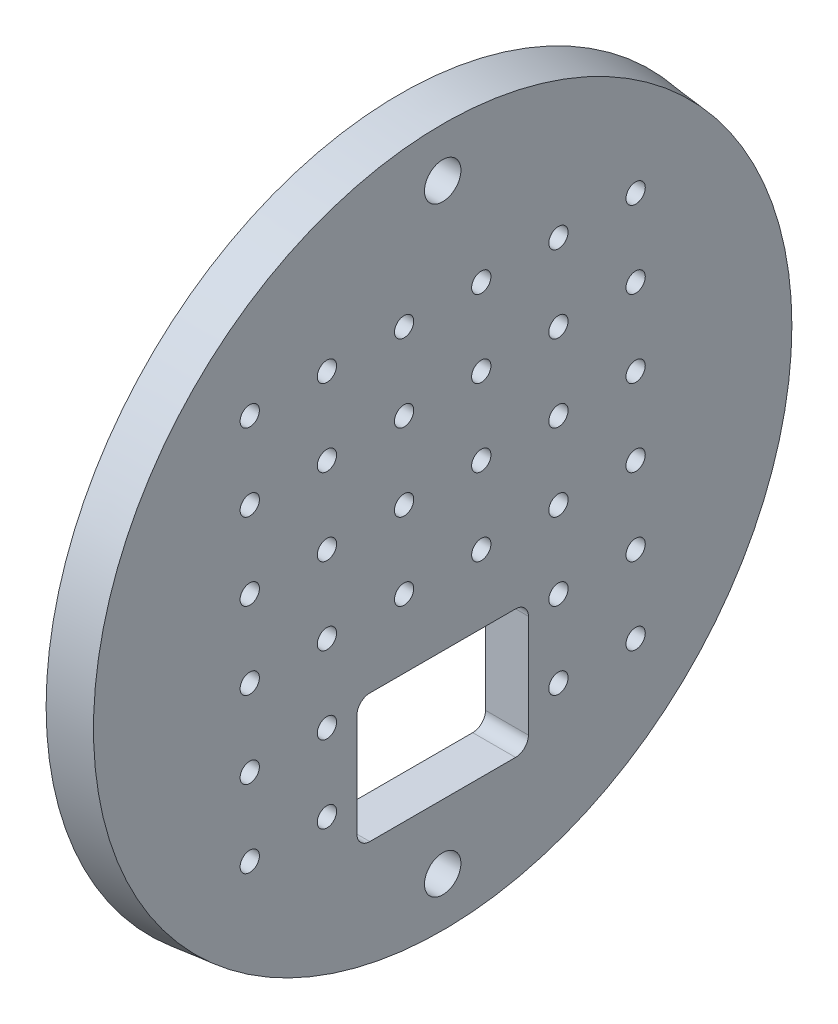
from build123d import *

# Parameters (mm, degrees)
SKETCH_1_R                  = 82.5
EXTRUDE_1_DEPTH             = 10
EXTRUDE_1_TAPER             = 6
SKETCH_2_R                  = 4.25
CUT_EXTRUDE_458_DEPTH       = 118.100384436
CUT_EXTRUDE_1221_REACH      = 119.1
CUT_EXTRUDE_1_REACH         = 119.1
SKETCH_7_R                  = 2.25
PATTERN_LINEAR_1_COUNT      = 6
PATTERN_LINEAR_1_PITCH      = 18
PATTERN_LINEAR_1_COUNT_DIR2 = 6
PATTERN_LINEAR_1_PITCH_DIR2 = 18
WRAP_START                  = -0.3
WRAP_1_DEPTH                = 0.3


# Read off the part's stored shape, not the designer's step: 包覆1
with BuildPart() as part:
    # 草圖1 → 填料-伸長1 (new body)
    with BuildSketch(Plane(origin=(0, 0, 0), x_dir=(0, 0, -1), z_dir=(1, 0, 0))):
        Circle(SKETCH_1_R)
    extrude(amount=EXTRUDE_1_DEPTH, taper=EXTRUDE_1_TAPER)

    # 草圖2 → Cut-Extrude 458 (cut, through all)
    with BuildSketch(Plane(origin=(10, 0, 0), x_dir=(0, 0, -1), z_dir=(1, 0, 0))):
        with Locations((0, 70)):
            Circle(SKETCH_2_R)
        with Locations(Location((0, -70, 0), (0, 0, 180))):
            Circle(SKETCH_2_R)
    extrude(amount=-CUT_EXTRUDE_458_DEPTH, mode=Mode.SUBTRACT)

    # 草圖8 → Cut-Extrude 1221 (cut, up to next)
    with BuildSketch(Plane(origin=(10, 0, 0), x_dir=(0, 0, -1), z_dir=(1, 0, 0)), mode=Mode.PRIVATE) as cut_extrude_1221_sk1:
        with BuildLine():
            Line((-17, -25), (17, -25))
            ThreePointArc((17, -25), (19.121320344, -25.878679656), (20, -28))
            Line((20, -28), (20, -52))
            ThreePointArc((20, -52), (19.121320344, -54.121320344), (17, -55))
            Line((17, -55), (-17, -55))
            ThreePointArc((-17, -55), (-19.121320344, -54.121320344), (-20, -52))
            Line((-20, -52), (-20, -28))
            ThreePointArc((-20, -28), (-19.121320344, -25.878679656), (-17, -25))
        make_face()
    cut_extrude_1221_tool1 = extrude(cut_extrude_1221_sk1.sketch, amount=-CUT_EXTRUDE_1221_REACH, mode=Mode.PRIVATE) & part.part
    add(cut_extrude_1221_tool1.solids().sort_by_distance((10, -40, 0))[0], mode=Mode.SUBTRACT)

    # 草圖7 → 除料-伸長1 (cut, up to next)
    with BuildSketch(Plane(origin=(10, 0, 0), x_dir=(0, 0, -1), z_dir=(1, 0, 0)), mode=Mode.PRIVATE) as cut_extrude_1_sk1:
        with Locations((-45, 45)):
            Circle(SKETCH_7_R)
    cut_extrude_1_tool1 = extrude(cut_extrude_1_sk1.sketch, amount=-CUT_EXTRUDE_1_REACH, mode=Mode.PRIVATE) & part.part
    cut_extrude_1 = cut_extrude_1_tool1.solids().sort_by_distance((10, 45, 45))[0]
    add(cut_extrude_1, mode=Mode.SUBTRACT)

    # 直線複製排列1: Cut-Extrude 1 6 × 6, 4 skipped
    with Locations(*[(0, -i * PATTERN_LINEAR_1_PITCH, -j * PATTERN_LINEAR_1_PITCH_DIR2) for i in range(PATTERN_LINEAR_1_COUNT) for j in range(PATTERN_LINEAR_1_COUNT_DIR2) if (i, j) not in ((0, 0), (4, 2), (4, 3), (5, 2), (5, 3))]):
        add(cut_extrude_1, mode=Mode.SUBTRACT)

    # 包覆1 outline → 包覆1 (cut)
    # profile 1 of 5: a face of its own
    with BuildSketch(Plane.ZY.offset(WRAP_START)):
        with BuildLine():
            add(Edge.make_bspline(
                [(4.76091402, -64.338842147), (4.738677425, -64.378285479), (4.695413817, -64.455026582), (4.621013069, -64.560458442), (4.543020996, -64.655306158), (4.457917028, -64.737035812), (4.368247349, -64.808287197), (4.273514695, -64.870625022), (4.173225877, -64.923743542), (4.067376152, -64.96849607), (3.955076601, -65.002905564), (3.836055084, -65.027209785), (3.710083589, -65.042233054), (3.623737409, -65.043978194), (3.579523796, -65.044871795)],
                knots=[0, 0, 0, 0, 0.093369857, 0.181660766, 0.265874227, 0.346354784, 0.424599862, 0.501903184, 0.579992091, 0.658443431, 0.738672236, 0.821894148, 0.908800792, 1, 1, 1, 1], degree=3))
            Line((4.76091402, -64.338842147), (4.481867546, -64.192307692))
            add(Edge.make_bspline(
                [(3.540260976, -64.730769231), (3.571612123, -64.730161174), (3.633818814, -64.728954673), (3.726459671, -64.717222762), (3.817599199, -64.698252487), (3.906860182, -64.672362496), (3.992431028, -64.640785644), (4.071676578, -64.602682787), (4.144556794, -64.56053304), (4.21267376, -64.512323365), (4.278744754, -64.453315178), (4.34428724, -64.379679457), (4.414563893, -64.292591929), (4.458553486, -64.227046263), (4.481867546, -64.192307692)],
                knots=[0, 0, 0, 0, 0.082592263, 0.163878894, 0.24565874, 0.327725695, 0.408609961, 0.485749086, 0.559169056, 0.630268476, 0.705306028, 0.792064966, 0.889796437, 1, 1, 1, 1], degree=3))
            add(Edge.make_bspline(
                [(2.607067867, -63.788461538), (2.608607473, -63.822162003), (2.611635047, -63.888432606), (2.62575019, -63.98540339), (2.647998964, -64.077776732), (2.679268027, -64.164859774), (2.717134872, -64.247789901), (2.763520589, -64.325951938), (2.818860143, -64.398989868), (2.880585842, -64.467557006), (2.949292937, -64.528617767), (3.021575684, -64.583269543), (3.098469249, -64.62907514), (3.179367333, -64.66625503), (3.264139118, -64.695361346), (3.352811313, -64.715229166), (3.44520943, -64.728536273), (3.508195164, -64.730015939), (3.540260976, -64.730769231)],
                knots=[0, 0, 0, 0, 0.068384615, 0.134475588, 0.198391058, 0.260753477, 0.321829223, 0.383037238, 0.444653123, 0.507398011, 0.569825238, 0.630777641, 0.690928687, 0.750945133, 0.811049477, 0.872330853, 0.935004094, 1, 1, 1, 1], degree=3))
            Line((2.607067867, -63.788461538), (4.895529405, -63.788461538))
            add(Edge.make_bspline(
                [(4.617184053, -62.900841346), (4.639310991, -62.931044928), (4.683417584, -62.991251046), (4.738664684, -63.089422203), (4.786622079, -63.192132798), (4.82495504, -63.301043095), (4.855994541, -63.414862675), (4.87845136, -63.53440522), (4.891620978, -63.659635131), (4.894209676, -63.744961686), (4.895529405, -63.788461538)],
                knots=[0, 0, 0, 0, 0.11852184, 0.236254763, 0.356174434, 0.477249655, 0.601539871, 0.729618382, 0.862158266, 1, 1, 1, 1], degree=3))
            add(Edge.make_bspline(
                [(3.587236136, -62.397435897), (3.639683741, -62.398789946), (3.742573987, -62.401446282), (3.892606108, -62.426072615), (4.034566825, -62.46512517), (4.168399329, -62.52027896), (4.29411719, -62.591438512), (4.410903239, -62.679580353), (4.520754752, -62.781998441), (4.584663331, -62.86076165), (4.617184053, -62.900841346)],
                knots=[0, 0, 0, 0, 0.132040234, 0.259032841, 0.381879824, 0.502258444, 0.62275219, 0.744742632, 0.870108927, 1, 1, 1, 1], degree=3))
            add(Edge.make_bspline(
                [(2.587436456, -62.874198718), (2.619144139, -62.836329848), (2.681555086, -62.761791697), (2.787111441, -62.663853372), (2.901411637, -62.581809596), (3.023023264, -62.51380246), (3.153359738, -62.462128813), (3.290669029, -62.423621231), (3.436514615, -62.40204322), (3.536219836, -62.398995386), (3.587236136, -62.397435897)],
                knots=[0, 0, 0, 0, 0.128835254, 0.253589335, 0.374643257, 0.495340042, 0.616324775, 0.739759335, 0.86684232, 1, 1, 1, 1], degree=3))
            add(Edge.make_bspline(
                [(2.292965303, -63.728165064), (2.294024444, -63.688870234), (2.296123522, -63.610993069), (2.309354309, -63.495727524), (2.332802603, -63.383699072), (2.364978926, -63.274814624), (2.406530173, -63.16925649), (2.457362392, -63.066960426), (2.51755477, -62.968035287), (2.564027443, -62.905632153), (2.587436456, -62.874198718)],
                knots=[0, 0, 0, 0, 0.128044808, 0.2537679, 0.377428427, 0.500550841, 0.623295883, 0.746578332, 0.872347541, 1, 1, 1, 1], degree=3))
            add(Edge.make_bspline(
                [(3.579523796, -65.044871795), (3.530381819, -65.04372462), (3.434520057, -65.041486813), (3.29498031, -65.022194348), (3.163600891, -64.99072199), (3.040389188, -64.946756448), (2.925646935, -64.889329124), (2.819146081, -64.819369642), (2.720326555, -64.737237388), (2.632302346, -64.642220944), (2.553058463, -64.540538987), (2.483132643, -64.434583102), (2.424675212, -64.324619878), (2.377122602, -64.211349354), (2.338717737, -64.09548546), (2.311951033, -63.975973993), (2.296521285, -63.853138408), (2.294156839, -63.770041073), (2.292965303, -63.728165064)],
                knots=[0, 0, 0, 0, 0.071578658, 0.139629225, 0.204796697, 0.268134963, 0.329813747, 0.391301398, 0.453433515, 0.51655169, 0.579631271, 0.641118921, 0.701294047, 0.760810336, 0.819931722, 0.878919575, 0.938982822, 1, 1, 1, 1], degree=3))
        make_face()
        with BuildLine():
            add(Edge.make_bspline(
                [(3.603361937, -62.711538462), (3.572012499, -62.712150133), (3.51004125, -62.713359279), (3.418740181, -62.724829408), (3.331060482, -62.743789253), (3.246355195, -62.76975421), (3.165734326, -62.804362812), (3.087539558, -62.844946039), (3.013759162, -62.894487623), (2.967617867, -62.932246478), (2.94430745, -62.951322115)],
                knots=[0, 0, 0, 0, 0.131091976, 0.259141276, 0.384161763, 0.505991952, 0.629098089, 0.750669123, 0.874038938, 1, 1, 1, 1], degree=3))
            add(Edge.make_bspline(
                [(4.581426841, -63.474358974), (4.569930216, -63.432696101), (4.547802915, -63.35250848), (4.50156655, -63.24146759), (4.44949501, -63.142779689), (4.387873278, -63.057200056), (4.318054553, -62.981196543), (4.23740937, -62.914777957), (4.146973477, -62.855360506), (4.047214336, -62.805208007), (3.941572551, -62.762518148), (3.830966359, -62.733893032), (3.718108571, -62.71428349), (3.641774285, -62.712457382), (3.603361937, -62.711538462)],
                knots=[0, 0, 0, 0, 0.096240125, 0.185231261, 0.267500523, 0.344400382, 0.419594869, 0.496890627, 0.576637919, 0.660267852, 0.745386615, 0.830040327, 0.914474212, 1, 1, 1, 1], degree=3))
            Line((4.581426841, -63.474358974), (2.640020591, -63.474358974))
            add(Edge.make_bspline(
                [(2.94430745, -62.951322115), (2.927614168, -62.966416431), (2.893831034, -62.996963647), (2.848690512, -63.049592854), (2.80547004, -63.106344416), (2.766136387, -63.16938954), (2.7300588, -63.238010319), (2.696298823, -63.311627955), (2.665912411, -63.390801085), (2.648816301, -63.445973524), (2.640020591, -63.474358974)],
                knots=[0, 0, 0, 0, 0.109983845, 0.222580497, 0.338499871, 0.458708565, 0.585535346, 0.717517743, 0.85466682, 1, 1, 1, 1], degree=3))
        make_face(mode=Mode.SUBTRACT)
    # profile 2 of 5: a face of its own
    with BuildSketch(Plane.ZY.offset(WRAP_START)):
        with BuildLine():
            add(Edge.make_bspline(
                [(1.496490944, -62.980769231), (1.47810044, -62.959456084), (1.442645714, -62.918366847), (1.386414233, -62.863429781), (1.33039063, -62.817292842), (1.275341816, -62.778340583), (1.219883547, -62.748891436), (1.164666629, -62.727396574), (1.10963389, -62.714094769), (1.072847855, -62.71238033), (1.054784213, -62.711538462)],
                knots=[0, 0, 0, 0, 0.158223098, 0.305035505, 0.441308964, 0.565963227, 0.683525114, 0.79333413, 0.898517512, 1, 1, 1, 1], degree=3))
            Line((1.496490944, -62.980769231), (1.709631969, -62.761318109))
            add(Edge.make_bspline(
                [(1.054784213, -62.397435897), (1.081976276, -62.398540238), (1.136870498, -62.400769636), (1.219225124, -62.418475326), (1.301458466, -62.447608431), (1.383781816, -62.487844664), (1.465592106, -62.53991154), (1.547608962, -62.602840839), (1.630816992, -62.676218554), (1.682773306, -62.732317779), (1.709631969, -62.761318109)],
                knots=[0, 0, 0, 0, 0.105714261, 0.213411613, 0.32612673, 0.444451672, 0.56906108, 0.702712204, 0.846317947, 1, 1, 1, 1], degree=3))
            add(Edge.make_bspline(
                [(0.408349918, -63.068409455), (0.408884113, -63.044784057), (0.409929609, -62.998545806), (0.418273661, -62.930606986), (0.433465372, -62.866058832), (0.452520295, -62.803931969), (0.479003299, -62.745429875), (0.510649204, -62.689772404), (0.547836629, -62.637036486), (0.59067992, -62.588033354), (0.637786565, -62.543524028), (0.688681335, -62.5047254), (0.742219591, -62.471619045), (0.798628011, -62.443853884), (0.858448484, -62.422852502), (0.92126287, -62.408395117), (0.986944025, -62.398739914), (1.031845151, -62.397876829), (1.054784213, -62.397435897)],
                knots=[0, 0, 0, 0, 0.06797849, 0.133043535, 0.196507438, 0.258613417, 0.319728338, 0.380872854, 0.442635602, 0.505079304, 0.56788052, 0.628813854, 0.688910091, 0.748765006, 0.809385783, 0.870884336, 0.934037463, 1, 1, 1, 1], degree=3))
            add(Edge.make_bspline(
                [(0.525437258, -63.462439904), (0.507306658, -63.433294289), (0.471039123, -63.374992874), (0.435823932, -63.277682397), (0.411617903, -63.175237339), (0.409455513, -63.104550485), (0.408349918, -63.068409455)],
                knots=[0, 0, 0, 0, 0.246252371, 0.492590796, 0.740569991, 1, 1, 1, 1], degree=3))
            add(Edge.make_bspline(
                [(0.966442867, -63.811598558), (0.940396227, -63.797059426), (0.889883479, -63.76886341), (0.818336188, -63.724947329), (0.753788834, -63.680280055), (0.694688259, -63.637367216), (0.642527254, -63.593946272), (0.597511305, -63.54996902), (0.55786809, -63.507209034), (0.535920678, -63.476911737), (0.525437258, -63.462439904)],
                knots=[0, 0, 0, 0, 0.157761664, 0.305950213, 0.443775499, 0.572824362, 0.692154156, 0.802295707, 0.905564392, 1, 1, 1, 1], degree=3))
            add(Edge.make_bspline(
                [(1.354163219, -64.075220353), (1.346140825, -64.06618499), (1.328665152, -64.046502708), (1.296609911, -64.01807763), (1.258228049, -63.98743953), (1.213087886, -63.955107941), (1.161098424, -63.921509336), (1.102048949, -63.886819984), (1.036748396, -63.849392258), (0.990577765, -63.824572603), (0.966442867, -63.811598558)],
                knots=[0, 0, 0, 0, 0.076875074, 0.167461676, 0.272270023, 0.389550841, 0.520801368, 0.666263293, 0.825544915, 1, 1, 1, 1], degree=3))
            add(Edge.make_bspline(
                [(1.4404012, -64.319210737), (1.439314906, -64.296901119), (1.437170163, -64.252853763), (1.420326891, -64.189103422), (1.393714039, -64.128634141), (1.36750939, -64.093244494), (1.354163219, -64.075220353)],
                knots=[0, 0, 0, 0, 0.253475435, 0.500453315, 0.745578135, 1, 1, 1, 1], degree=3))
            add(Edge.make_bspline(
                [(0.988878764, -64.730769231), (1.01919669, -64.729398406), (1.078432832, -64.726720044), (1.16327659, -64.702402952), (1.241615217, -64.664273), (1.309638562, -64.610188302), (1.367540723, -64.547232729), (1.409468898, -64.47631861), (1.435745073, -64.399527153), (1.438831072, -64.346294851), (1.4404012, -64.319210737)],
                knots=[0, 0, 0, 0, 0.134042046, 0.261895674, 0.387836045, 0.517686206, 0.644508654, 0.764718263, 0.880290782, 1, 1, 1, 1], degree=3))
            add(Edge.make_bspline(
                [(0.481967706, -64.461538462), (0.501740119, -64.482893226), (0.540071932, -64.524292666), (0.601373148, -64.579417007), (0.663752549, -64.625618278), (0.726587236, -64.664261693), (0.79080733, -64.694037096), (0.856052945, -64.71495569), (0.922191369, -64.728399882), (0.966613504, -64.729978164), (0.988878764, -64.730769231)],
                knots=[0, 0, 0, 0, 0.147475818, 0.285904172, 0.417171648, 0.540500744, 0.659237718, 0.775006098, 0.887228573, 1, 1, 1, 1], degree=3))
            Line((0.481967706, -64.461538462), (0.273734533, -64.698517628))
            add(Edge.make_bspline(
                [(1.005004565, -65.044871795), (0.96963739, -65.043879095), (0.899394463, -65.041907487), (0.795504744, -65.023401426), (0.693983985, -64.994606032), (0.595600445, -64.954890098), (0.502554331, -64.904739385), (0.417423406, -64.844676992), (0.339911944, -64.776686994), (0.29579367, -64.724574084), (0.273734533, -64.698517628)],
                knots=[0, 0, 0, 0, 0.126742519, 0.251723961, 0.377218688, 0.504693549, 0.631458239, 0.755401067, 0.877700534, 1, 1, 1, 1], degree=3))
            add(Edge.make_bspline(
                [(1.754503764, -64.305889423), (1.75378423, -64.331158569), (1.75236631, -64.380954182), (1.742508243, -64.454289012), (1.725553267, -64.52442357), (1.702459513, -64.592118854), (1.67127514, -64.656077794), (1.634727343, -64.717914043), (1.590852431, -64.776289974), (1.540761056, -64.831128934), (1.485915562, -64.881214681), (1.427409423, -64.925238635), (1.365170593, -64.961812972), (1.299643791, -64.992078318), (1.230680137, -65.016146576), (1.158268848, -65.032809107), (1.082640093, -65.042781868), (1.031210285, -65.044166344), (1.005004565, -65.044871795)],
                knots=[0, 0, 0, 0, 0.064548126, 0.127199133, 0.188597338, 0.248639515, 0.309524699, 0.370036991, 0.431889244, 0.495704286, 0.559519328, 0.62137158, 0.682397107, 0.743568482, 0.805498484, 0.868639701, 0.933066225, 1, 1, 1, 1], degree=3))
            add(Edge.make_bspline(
                [(1.635313059, -63.910456731), (1.653523586, -63.940122819), (1.689765916, -63.99916384), (1.727824182, -64.096382267), (1.749884457, -64.19949277), (1.752946677, -64.27002499), (1.754503764, -64.305889423)],
                knots=[0, 0, 0, 0, 0.248838614, 0.495235025, 0.743335604, 1, 1, 1, 1], degree=3))
            add(Edge.make_bspline(
                [(1.17467604, -63.551482372), (1.201889617, -63.566727275), (1.254457287, -63.596175407), (1.329150054, -63.641885111), (1.396937095, -63.687316535), (1.458392763, -63.731983809), (1.512334572, -63.777136676), (1.560399124, -63.821044433), (1.601387568, -63.865033742), (1.624341495, -63.895766855), (1.635313059, -63.910456731)],
                knots=[0, 0, 0, 0, 0.158989101, 0.307114592, 0.446213159, 0.574876072, 0.69415211, 0.80458118, 0.906593319, 1, 1, 1, 1], degree=3))
            add(Edge.make_bspline(
                [(0.809391585, -63.287860577), (0.817355078, -63.297645161), (0.834304371, -63.318470416), (0.866112886, -63.347374269), (0.902135389, -63.37931652), (0.945455327, -63.411253357), (0.994206355, -63.444885082), (1.049445639, -63.478887215), (1.109420144, -63.51585164), (1.15235745, -63.539296076), (1.17467604, -63.551482372)],
                knots=[0, 0, 0, 0, 0.083425105, 0.177559821, 0.28398236, 0.402216747, 0.53356848, 0.676120994, 0.831649373, 1, 1, 1, 1], degree=3))
            add(Edge.make_bspline(
                [(0.722452482, -63.055789263), (0.723563294, -63.076001307), (0.725781787, -63.116368418), (0.743028467, -63.175916452), (0.770494539, -63.23397349), (0.796164733, -63.269536396), (0.809391585, -63.287860577)],
                knots=[0, 0, 0, 0, 0.240039931, 0.479403194, 0.731756739, 1, 1, 1, 1], degree=3))
            add(Edge.make_bspline(
                [(1.054784213, -62.711538462), (1.032644823, -62.712613335), (0.989077637, -62.714728532), (0.926651819, -62.735841963), (0.868701194, -62.768250701), (0.818544214, -62.814219285), (0.776056534, -62.866983554), (0.745042853, -62.925979878), (0.726076869, -62.989427922), (0.723672137, -63.03345778), (0.722452482, -63.055789263)],
                knots=[0, 0, 0, 0, 0.124958493, 0.245900629, 0.36916603, 0.498510841, 0.628503866, 0.751028329, 0.873724174, 1, 1, 1, 1], degree=3))
        make_face()
    # profile 3 of 5: a face of its own
    with BuildSketch(Plane.ZY.offset(WRAP_START)):
        with BuildLine():
            add(Edge.make_bspline(
                [(-0.533957774, -64.557592147), (-0.569376565, -64.597631741), (-0.63849678, -64.675769512), (-0.753937898, -64.777851685), (-0.876306076, -64.862230007), (-1.005007397, -64.930379922), (-1.139925641, -64.981571979), (-1.280761728, -65.017958138), (-1.427573109, -65.041351973), (-1.527825464, -65.043687995), (-1.578629249, -65.044871795)],
                knots=[0, 0, 0, 0, 0.134298379, 0.262084975, 0.386269912, 0.507164597, 0.627300236, 0.748144942, 0.872370177, 1, 1, 1, 1], degree=3))
            Line((-0.533957774, -64.557592147), (-0.533957774, -65))
            Line((-0.533957774, -65), (-0.21985521, -65))
            Line((-0.21985521, -65), (-0.21985521, -62.442307692))
            Line((-0.21985521, -62.442307692), (-0.533957774, -62.442307692))
            Line((-0.533957774, -62.442307692), (-0.533957774, -62.915564904))
            add(Edge.make_bspline(
                [(-1.568813544, -62.397435897), (-1.516613685, -62.398873649), (-1.414252225, -62.401693012), (-1.264524215, -62.425155739), (-1.122879737, -62.464794206), (-0.988225385, -62.518711704), (-0.861044699, -62.590360433), (-0.742541715, -62.680740394), (-0.631476232, -62.789281581), (-0.56709594, -62.872652026), (-0.533957774, -62.915564904)],
                knots=[0, 0, 0, 0, 0.129862142, 0.254653531, 0.376014554, 0.495255252, 0.614797719, 0.738105554, 0.8651963, 1, 1, 1, 1], degree=3))
            add(Edge.make_bspline(
                [(-2.912162903, -63.714142628), (-2.910909931, -63.669678925), (-2.908432874, -63.581776581), (-2.889979655, -63.452497883), (-2.858948646, -63.327979623), (-2.815400798, -63.208622679), (-2.759558843, -63.094282629), (-2.691630756, -62.984878604), (-2.611611632, -62.880109207), (-2.519359225, -62.78243798), (-2.419424454, -62.692217366), (-2.312515723, -62.61380832), (-2.201292442, -62.546091471), (-2.084029432, -62.492437995), (-1.962462327, -62.449028891), (-1.835508881, -62.418995922), (-1.703697302, -62.401298601), (-1.61420681, -62.398735837), (-1.568813544, -62.397435897)],
                knots=[0, 0, 0, 0, 0.063774532, 0.12607881, 0.186904093, 0.247573935, 0.308003356, 0.369131898, 0.432033228, 0.496790794, 0.561610823, 0.624913866, 0.686726349, 0.748078833, 0.809582291, 0.871630743, 0.934885821, 1, 1, 1, 1], degree=3))
            add(Edge.make_bspline(
                [(-1.578629249, -65.044871795), (-1.623797203, -65.043645423), (-1.712870408, -65.041226962), (-1.843899485, -65.022464659), (-1.969991734, -64.992334037), (-2.091266307, -64.950433147), (-2.206938452, -64.894852326), (-2.317998549, -64.828311078), (-2.423871241, -64.749070248), (-2.52294278, -64.658482219), (-2.61417478, -64.560087232), (-2.694236053, -64.455141685), (-2.760989133, -64.344099381), (-2.816809213, -64.228366227), (-2.859805558, -64.107051308), (-2.889779192, -63.98057414), (-2.908519639, -63.849084266), (-2.910937099, -63.759544743), (-2.912162903, -63.714142628)],
                knots=[0, 0, 0, 0, 0.064619991, 0.127433484, 0.189004127, 0.249930071, 0.310668454, 0.372328961, 0.43493911, 0.499575544, 0.564191208, 0.626735217, 0.688109334, 0.749293607, 0.810330528, 0.87190117, 0.935045915, 1, 1, 1, 1], degree=3))
        make_face()
        with BuildLine():
            add(Edge.make_bspline(
                [(-2.598060339, -63.717648237), (-2.596195445, -63.761238344), (-2.592472968, -63.8482477), (-2.565722274, -63.977228277), (-2.520842401, -64.102882319), (-2.459600338, -64.224143313), (-2.382913713, -64.336727413), (-2.294025061, -64.438467536), (-2.192074779, -64.525957124), (-2.079147272, -64.599194697), (-1.958539302, -64.658357218), (-1.83170537, -64.699522858), (-1.701029732, -64.726100638), (-1.612177398, -64.729205115), (-1.5674113, -64.730769231)],
                knots=[0, 0, 0, 0, 0.081589349, 0.162858895, 0.245483689, 0.330807139, 0.416493374, 0.499893203, 0.583048156, 0.667157852, 0.751311929, 0.833784789, 0.916256489, 1, 1, 1, 1], degree=3))
            add(Edge.make_bspline(
                [(-1.564606813, -62.711538462), (-1.610521151, -62.713172099), (-1.701148751, -62.71639664), (-1.834192753, -62.741570135), (-1.961506167, -62.78345473), (-2.082452241, -62.840736631), (-2.195120458, -62.912765368), (-2.295814129, -62.999886751), (-2.38535683, -63.099723765), (-2.460665094, -63.211825875), (-2.522055591, -63.332003967), (-2.565222623, -63.457628405), (-2.59369187, -63.586433382), (-2.596600391, -63.673796068), (-2.598060339, -63.717648237)],
                knots=[0, 0, 0, 0, 0.085920517, 0.169593435, 0.252475515, 0.336244477, 0.419504521, 0.502035907, 0.584774648, 0.669846475, 0.754184866, 0.836658238, 0.918009726, 1, 1, 1, 1], degree=3))
            add(Edge.make_bspline(
                [(-0.533957774, -63.726762821), (-0.534917431, -63.69142499), (-0.536806338, -63.621868957), (-0.551236908, -63.519741439), (-0.574191834, -63.422007713), (-0.606538004, -63.328565024), (-0.649029289, -63.239930009), (-0.700277054, -63.155466248), (-0.761182504, -63.075613037), (-0.8307652, -63.001469966), (-0.906930403, -62.933843504), (-0.987524943, -62.873479263), (-1.07350369, -62.82389049), (-1.163420727, -62.782849219), (-1.257432062, -62.750190069), (-1.356302682, -62.728402375), (-1.458981669, -62.713442054), (-1.529027724, -62.712179673), (-1.564606813, -62.711538462)],
                knots=[0, 0, 0, 0, 0.0656338, 0.129188088, 0.191218683, 0.251912818, 0.312507474, 0.373494434, 0.4351516, 0.498741474, 0.562095217, 0.624186567, 0.685475718, 0.746096815, 0.807611636, 0.869966581, 0.933951019, 1, 1, 1, 1], degree=3))
            add(Edge.make_bspline(
                [(-1.5674113, -64.730769231), (-1.521964797, -64.729109267), (-1.431576211, -64.725807763), (-1.298137503, -64.700526498), (-1.16864254, -64.6587577), (-1.044855312, -64.600858573), (-0.929539181, -64.529101217), (-0.826041303, -64.445094126), (-0.738525335, -64.347390942), (-0.664332725, -64.240014489), (-0.606157308, -64.122302492), (-0.563781249, -63.996968302), (-0.538727343, -63.864007553), (-0.535569614, -63.773143626), (-0.533957774, -63.726762821)],
                knots=[0, 0, 0, 0, 0.084802388, 0.16866354, 0.252551924, 0.338239689, 0.423102661, 0.505556051, 0.586175656, 0.66713572, 0.74849918, 0.830452399, 0.913455706, 1, 1, 1, 1], degree=3))
        make_face(mode=Mode.SUBTRACT)
    # profile 4 of 5: a face of its own
    with BuildSketch(Plane.ZY.offset(WRAP_START)):
        with BuildLine():
            add(Edge.make_bspline(
                [(-4.831834377, -61.5), (-4.798405899, -61.50017575), (-4.733613188, -61.500516398), (-4.639393747, -61.50579953), (-4.551144936, -61.513003199), (-4.468841164, -61.524433292), (-4.392520461, -61.538225069), (-4.321952824, -61.554926885), (-4.257362652, -61.574953499), (-4.180249915, -61.60679978), (-4.092329254, -61.654122949), (-3.997130862, -61.724051514), (-3.915726622, -61.809583977), (-3.845540305, -61.906066632), (-3.789739186, -62.012202404), (-3.749369888, -62.125461593), (-3.723812013, -62.244383335), (-3.721183579, -62.326026513), (-3.71985521, -62.36728766)],
                knots=[0, 0, 0, 0, 0.062594097, 0.121322939, 0.176680142, 0.228365096, 0.276868446, 0.321879128, 0.364098625, 0.403355696, 0.477967948, 0.550535461, 0.623584457, 0.698174882, 0.77335367, 0.847281125, 0.92281834, 1, 1, 1, 1], degree=3))
            Line((-4.831834377, -61.5), (-5.514727005, -61.5))
            Line((-5.514727005, -61.5), (-5.514727005, -65))
            Line((-5.514727005, -65), (-4.568212582, -65))
            add(Edge.make_bspline(
                [(-3.450624441, -64.006510417), (-3.451601287, -64.040677289), (-3.453523259, -64.107901567), (-3.467703231, -64.206656701), (-3.491712338, -64.301031648), (-3.524783484, -64.391636831), (-3.567945799, -64.478296965), (-3.620473763, -64.561110229), (-3.683105327, -64.63924456), (-3.753168196, -64.713568183), (-3.832430341, -64.78039597), (-3.917946096, -64.839911677), (-4.010792416, -64.888857739), (-4.10944441, -64.929973761), (-4.215008726, -64.961380959), (-4.327011333, -64.983353533), (-4.445355635, -64.99815857), (-4.526565386, -64.999375775), (-4.568212582, -65)],
                knots=[0, 0, 0, 0, 0.061160277, 0.120334558, 0.178180255, 0.235235126, 0.292682961, 0.351186248, 0.41045661, 0.471719854, 0.533761203, 0.595739024, 0.657887515, 0.72129518, 0.786822515, 0.854686154, 0.925477986, 1, 1, 1, 1], degree=3))
            add(Edge.make_bspline(
                [(-4.124402486, -63.111879006), (-4.084642058, -63.127144005), (-4.008570511, -63.15634973), (-3.903884499, -63.207985194), (-3.813689654, -63.264147304), (-3.737292508, -63.325479154), (-3.671954853, -63.391587965), (-3.614901911, -63.463443079), (-3.566220537, -63.541981837), (-3.524507613, -63.626385373), (-3.491958857, -63.715791841), (-3.467582953, -63.809362617), (-3.453615504, -63.906762172), (-3.451627863, -63.973047552), (-3.450624441, -64.006510417)],
                knots=[0, 0, 0, 0, 0.106057493, 0.202914257, 0.290300165, 0.370222566, 0.446383721, 0.5213969, 0.598291083, 0.676142469, 0.7555287, 0.834887172, 0.916646049, 1, 1, 1, 1], degree=3))
            add(Edge.make_bspline(
                [(-3.71985521, -62.36728766), (-3.720948429, -62.405940216), (-3.723096706, -62.481896133), (-3.743639465, -62.592990242), (-3.775800134, -62.698741461), (-3.820505383, -62.798763846), (-3.878607379, -62.89079746), (-3.947465698, -62.975584726), (-4.0305425, -63.049535783), (-4.09278574, -63.090878685), (-4.124402486, -63.111879006)],
                knots=[0, 0, 0, 0, 0.130569107, 0.256580609, 0.380551617, 0.503622917, 0.625739323, 0.747548582, 0.871766119, 1, 1, 1, 1], degree=3))
        make_face()
        with BuildLine():
            add(Edge.make_bspline(
                [(-4.753308736, -64.641025641), (-4.72128981, -64.640641894), (-4.659577551, -64.639902271), (-4.570476321, -64.637487717), (-4.487893218, -64.631995441), (-4.412205082, -64.623349591), (-4.342594629, -64.613971142), (-4.279896926, -64.601359861), (-4.223603733, -64.586910901), (-4.158329425, -64.564576728), (-4.084825917, -64.529880257), (-4.00561506, -64.477566031), (-3.935188842, -64.415242723), (-3.875383583, -64.343111809), (-3.826370594, -64.264680482), (-3.790715139, -64.181535132), (-3.768724283, -64.095049605), (-3.766062113, -64.036082892), (-3.764727005, -64.006510417)],
                knots=[0, 0, 0, 0, 0.072502489, 0.139738989, 0.201795135, 0.259821934, 0.312205989, 0.360773434, 0.404540343, 0.443698099, 0.516840794, 0.587874336, 0.657965418, 0.728969389, 0.79930772, 0.866635778, 0.933116329, 1, 1, 1, 1], degree=3))
            Line((-4.753308736, -64.641025641), (-5.200624441, -64.641025641))
            Line((-5.200624441, -64.641025641), (-5.200624441, -63.33974359))
            Line((-5.200624441, -63.33974359), (-4.992391268, -63.33974359))
            add(Edge.make_bspline(
                [(-4.337543512, -63.381109776), (-4.354572607, -63.377654692), (-4.3914952, -63.370163357), (-4.45170278, -63.362255654), (-4.520438649, -63.355210594), (-4.597861526, -63.349999436), (-4.684069367, -63.344612893), (-4.779246286, -63.342518071), (-4.883003601, -63.340018811), (-4.954995973, -63.339837677), (-4.992391268, -63.33974359)],
                knots=[0, 0, 0, 0, 0.079306486, 0.171952819, 0.277056507, 0.394730576, 0.526177321, 0.671344767, 0.829285257, 1, 1, 1, 1], degree=3))
            add(Edge.make_bspline(
                [(-3.764727005, -64.006510417), (-3.76500311, -63.988017076), (-3.765550865, -63.951328694), (-3.77381148, -63.897412875), (-3.785825349, -63.845187002), (-3.801356783, -63.794509261), (-3.82397625, -63.746295885), (-3.850382795, -63.699593325), (-3.881344197, -63.654339846), (-3.929588363, -63.597127593), (-3.999760347, -63.53121058), (-4.099467123, -63.466673077), (-4.212839421, -63.41462527), (-4.295066914, -63.392525794), (-4.337543512, -63.381109776)],
                knots=[0, 0, 0, 0, 0.060287398, 0.119602355, 0.177503371, 0.235142664, 0.292132593, 0.350871209, 0.410097863, 0.470731522, 0.594828704, 0.722578824, 0.85669139, 1, 1, 1, 1], degree=3))
        make_face(mode=Mode.SUBTRACT)
        with BuildLine():
            add(Edge.make_bspline(
                [(-4.989586781, -62.980769231), (-4.958737985, -62.980369308), (-4.899131826, -62.979596575), (-4.81281193, -62.977383058), (-4.732686911, -62.971185015), (-4.658895078, -62.964988752), (-4.591552634, -62.954914165), (-4.530808773, -62.942922042), (-4.475710176, -62.930239137), (-4.41217063, -62.90866965), (-4.340097682, -62.876791975), (-4.263264578, -62.827320139), (-4.195530108, -62.768395785), (-4.138332921, -62.700404824), (-4.09152145, -62.625538638), (-4.059007735, -62.544991757), (-4.036960451, -62.460771625), (-4.034968919, -62.402953373), (-4.033957774, -62.373597756)],
                knots=[0, 0, 0, 0, 0.072301034, 0.139700332, 0.202288511, 0.260599533, 0.313190329, 0.361738933, 0.405706476, 0.445539985, 0.518831956, 0.58977824, 0.658867479, 0.728430478, 0.797282704, 0.864815377, 0.931363753, 1, 1, 1, 1], degree=3))
            Line((-4.989586781, -62.980769231), (-5.200624441, -62.980769231))
            Line((-5.200624441, -62.980769231), (-5.200624441, -61.858974359))
            Line((-5.200624441, -61.858974359), (-4.77434239, -61.858974359))
            add(Edge.make_bspline(
                [(-4.033957774, -62.373597756), (-4.034483955, -62.354171985), (-4.035516114, -62.316066213), (-4.043969417, -62.260516859), (-4.058336992, -62.208273106), (-4.076791285, -62.158618996), (-4.102579973, -62.113107146), (-4.132943437, -62.07016395), (-4.169629127, -62.031251831), (-4.21138644, -61.994882333), (-4.259395063, -61.962637805), (-4.313626354, -61.934397042), (-4.374814031, -61.911656265), (-4.441926886, -61.891740113), (-4.515997974, -61.877751819), (-4.596172527, -61.866098431), (-4.683107246, -61.860165689), (-4.743252349, -61.859380327), (-4.77434239, -61.858974359)],
                knots=[0, 0, 0, 0, 0.057003133, 0.111817869, 0.164402372, 0.215869805, 0.26684111, 0.317478963, 0.369902136, 0.423400449, 0.479718398, 0.539241497, 0.602430689, 0.671029546, 0.744484798, 0.823453971, 0.908740313, 1, 1, 1, 1], degree=3))
        make_face(mode=Mode.SUBTRACT)
    # profile 5 of 5: a face of its own
    with BuildSketch(Plane.ZY.offset(WRAP_START)):
        Polygon((7.677580687, -63.833333333), (7.273734533, -63.833333333), (7.273734533, -61.41025641), (7.20993245, -61.41025641), (5.299375559, -64.192307692), (6.959631969, -64.192307692), (6.959631969, -65), (7.273734533, -65), (7.273734533, -64.192307692), (7.677580687, -64.192307692), align=None)
        Polygon((6.959631969, -62.313301282), (6.959631969, -63.833333333), (5.916362738, -63.833333333), align=None, mode=Mode.SUBTRACT)
    extrude(amount=WRAP_1_DEPTH, mode=Mode.SUBTRACT)


solid = part.part
